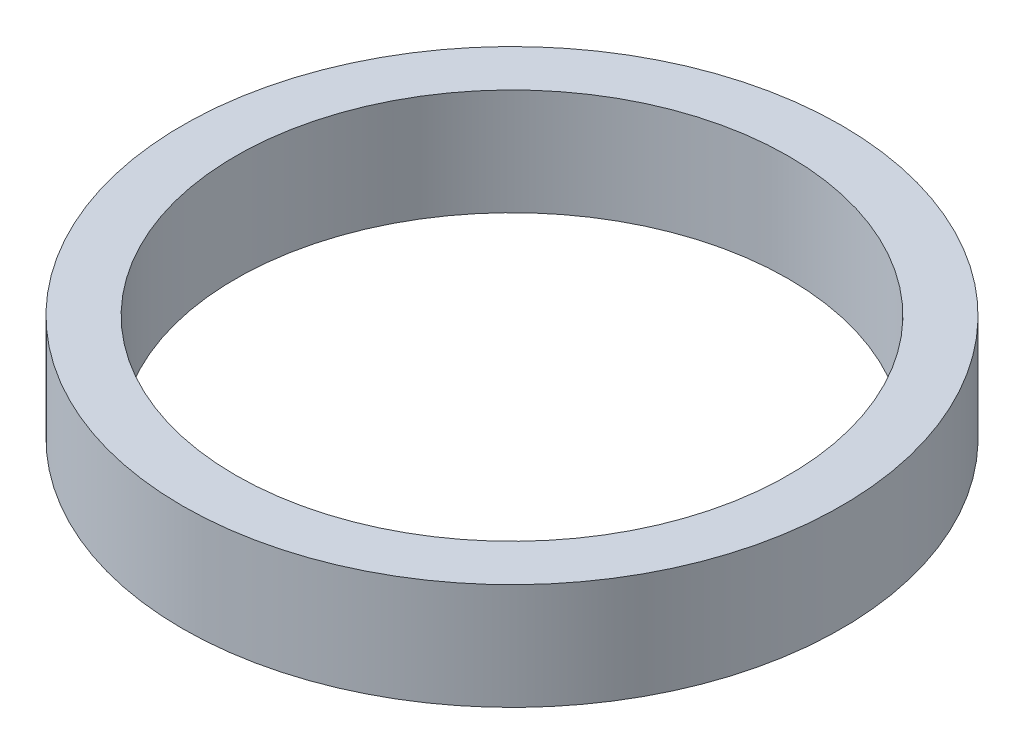
from build123d import *

# Parameters (mm, degrees)
SKETCH1_R           = 31
SKETCH1_R_2         = 26
BOSS_EXTRUDE1_DEPTH = 10


with BuildPart() as part:
    # Sketch1 → Boss-Extrude1 (new body)
    with BuildSketch(Plane(origin=(0, 0, 0), x_dir=(1, 0, 0), z_dir=(0, 1, 0))):
        Circle(SKETCH1_R)
        Circle(SKETCH1_R_2, mode=Mode.SUBTRACT)
    extrude(amount=BOSS_EXTRUDE1_DEPTH)


solid = part.part
